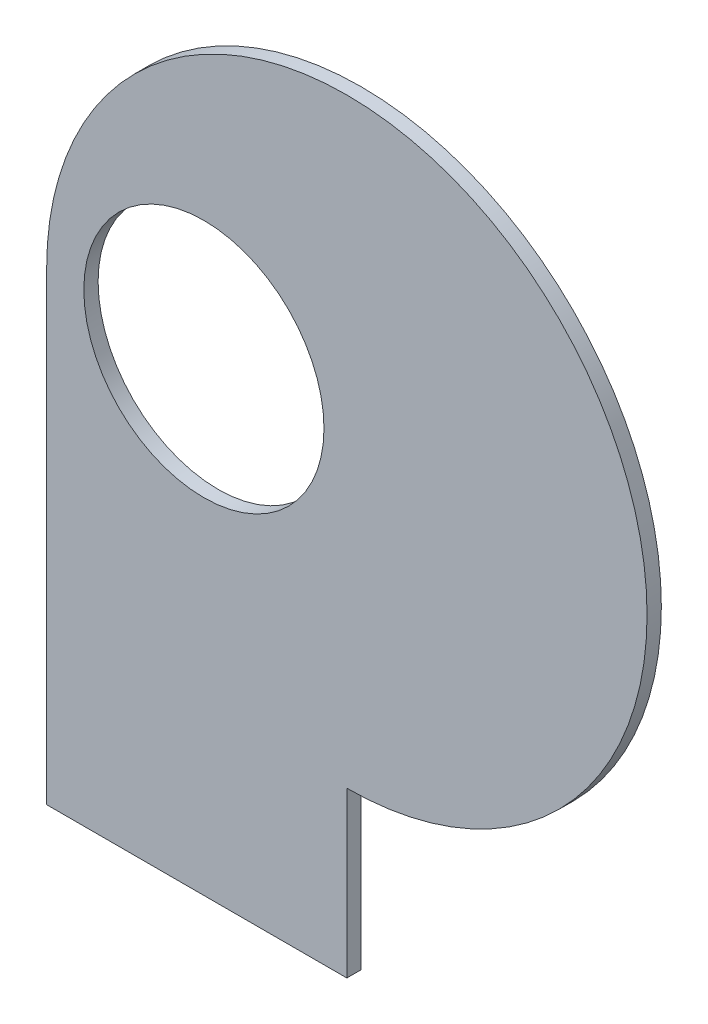
from build123d import *

# Parameters (mm, degrees)
SKETCH1_R           = 26.67
BOSS_EXTRUDE1_DEPTH = 3.175
CUT_EXTRUDE1_REACH  = 144.628


with BuildPart() as part:
    # Sketch1 → Boss-Extrude1 (new body)
    with BuildSketch(Plane.XY):
        with BuildLine():
            Line((-34.925, 0), (-34.925, -63.5))
            Line((-34.925, -63.5), (-34.925, -103.175))
            Line((-34.925, -103.175), (98.425, -103.175))
            Line((98.425, -103.175), (98.425, -64.833888838))
            Line((98.425, -64.833888838), (98.425, 0))
            ThreePointArc((98.425, 0), (31.75, 66.675), (-34.925, 0))
        make_face()
        Circle(SKETCH1_R, mode=Mode.SUBTRACT)
    extrude(amount=BOSS_EXTRUDE1_DEPTH)

    # Sketch2 → Cut-Extrude1 (cut, up to next)
    with BuildSketch(Plane.XY.offset(3.175), mode=Mode.PRIVATE) as cut_extrude1_sk1:
        with BuildLine():
            Line((31.75, -66.675), (31.75, -103.175))
            Line((31.75, -103.175), (98.425, -103.175))
            Line((98.425, -103.175), (98.425, 0))
            ThreePointArc((98.425, 0), (78.896344636, -47.146344636), (31.75, -66.675))
        make_face()
    cut_extrude1_tool1 = extrude(cut_extrude1_sk1.sketch, amount=-CUT_EXTRUDE1_REACH, mode=Mode.PRIVATE) & part.part
    add(cut_extrude1_tool1.solids().sort_by_distance((70.281775, -75.59134, 3.175))[0], mode=Mode.SUBTRACT)


solid = part.part
